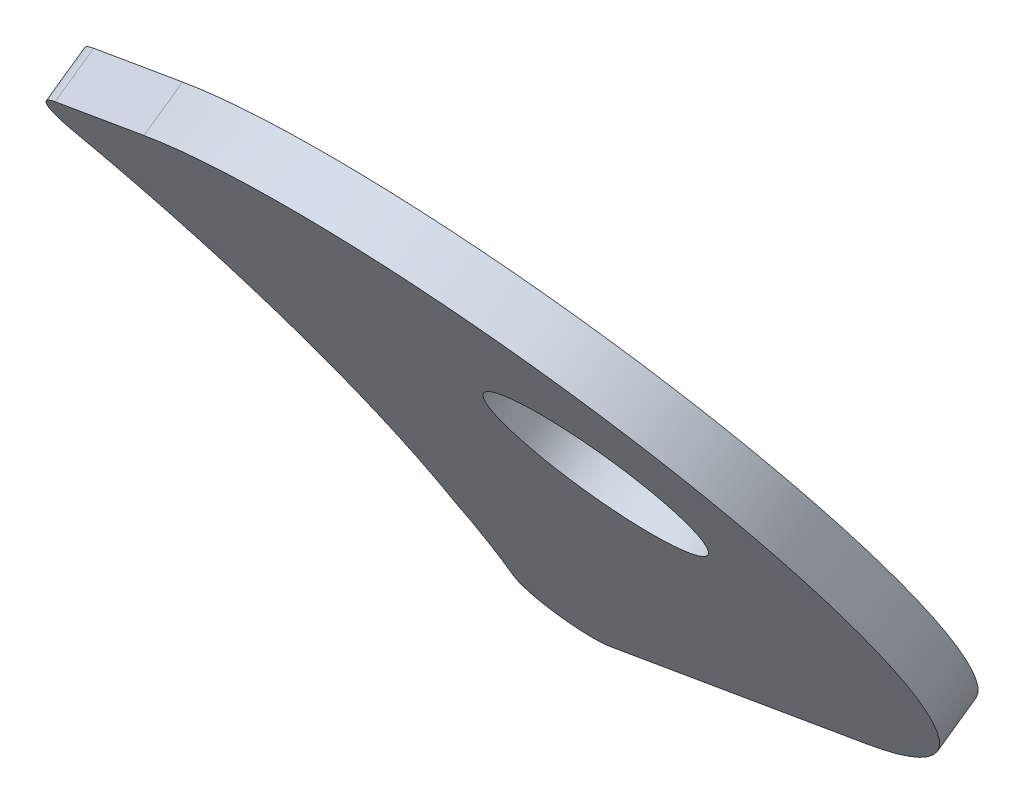
from build123d import *

# Parameters (mm, degrees)
SKETCH1_R           = 3.3020000000000405
BOSS_EXTRUDE1_DEPTH = 1.5875
SKETCH2_R           = 12.7
CUT_EXTRUDE1_DEPTH  = 164.69798740092241
CUT_EXTRUDE2_DEPTH  = 399.2312021708926
CUT_EXTRUDE3_DEPTH  = 399.2322845032196
FILLET1_R           = 1.5875


with BuildPart() as part:
    # Sketch1 → Boss-Extrude1 (new body)
    with BuildSketch(Plane(origin=(-4.904e-14, 229.6997332170858, -328.0452161431734), x_dir=(1, 7e-17, -1e-16), z_dir=(0, -0.5735764363510497, 0.8191520442889892))):
        with BuildLine():
            Line((356.2998896252525, 70.55163741306428), (376.9254322382814, 80.82199071424783))
            ThreePointArc((376.9254322382814, 80.82199071424783), (382.63309358192566, 97.85145347695013), (365.6036308192234, 103.55911482059432))
            Line((365.6036308192234, 103.55911482059432), (344.97808820619434, 93.28876151941097))
            Line((344.97808820619434, 93.28876151941097), (356.2998896252525, 70.55163741306428))
        make_face()
        with Locations((375.5277422986924, 94.3133905334945)):
            Circle(SKETCH1_R, mode=Mode.SUBTRACT)
    extrude(amount=BOSS_EXTRUDE1_DEPTH)

    # Sketch2 → Cut-Extrude1 (cut, through all)
    with BuildSketch(Plane(origin=(364.35174229869244, 343.62540364794484, -135.39966553044988), x_dir=(-0.9960075449626111, 0.027318171664055604, 0.08498639817338811), z_dir=(-0.0892690897094424, -0.3047987291070713, -0.9482240053685426))):
        Circle(SKETCH2_R)
    extrude(amount=CUT_EXTRUDE1_DEPTH, mode=Mode.SUBTRACT)

    # Sketch3 → Cut-Extrude2 (cut, through all)
    with BuildSketch(Plane(origin=(-4.885e-14, 228.78918062437845, -326.7448122728647), x_dir=(1, 7e-17, -1e-16), z_dir=(0, -0.5735764363510497, 0.8191520442889892))):
        with BuildLine():
            Line((359.8287026568516, 100.68352732070262), (358.4382239247449, 99.99114758047237))
            Line((358.4382239247449, 99.99114758047237), (360.8702636019665, 72.82742507790554))
            add(Edge.make_bspline(
                [(360.8702636019665, 72.82742507790554), (368.2083080665997, 89.03003410456597), (359.8287026568516, 100.68352732070262)],
                knots=[4.218717035603661, 4.218717035603661, 4.218717035603661, 5.696136664554478, 5.696136664554478, 5.696136664554478], degree=2, weights=[1, 0.7393379003717987, 1]))
        make_face()
    extrude(amount=-CUT_EXTRUDE2_DEPTH, mode=Mode.SUBTRACT)

    # Sketch4 → Cut-Extrude3 (cut, through all)
    with BuildSketch(Plane(origin=(-4.904e-14, 229.6997332170858, -328.0452161431734), x_dir=(-1, -7e-17, 1e-16), z_dir=(0, 0.5735764363510497, -0.8191520442889892))):
        with BuildLine():
            Line((-361.6174533376439, 73.19948329292563), (-360.8702636019665, 72.82742507790549))
            Line((-360.8702636019665, 72.82742507790549), (-363.361378453228, 81.54873685940132))
            add(Edge.make_bspline(
                [(-363.361378453228, 81.54873685940132), (-363.00233152155374, 77.177344146135), (-361.6174533376439, 73.19948329292563)],
                knots=[1.5208655376076283, 1.5208655376076283, 1.5208655376076283, 1.9311023959162479, 1.9311023959162479, 1.9311023959162479], degree=2, weights=[1, 0.9790368693670761, 1]))
        make_face()
    extrude(amount=-CUT_EXTRUDE3_DEPTH, mode=Mode.SUBTRACT)

    # Fillet1
    fillet1_edges = [part.edges().sort_by_distance(p)[0] for p in [
        (359.82870265685153, 311.719574151712, -269.64531540815693),
        (361.61745333764384, 289.2059633010299, -285.4095154381246),
    ]]
    fillet(fillet1_edges, radius=FILLET1_R)


solid = part.part
